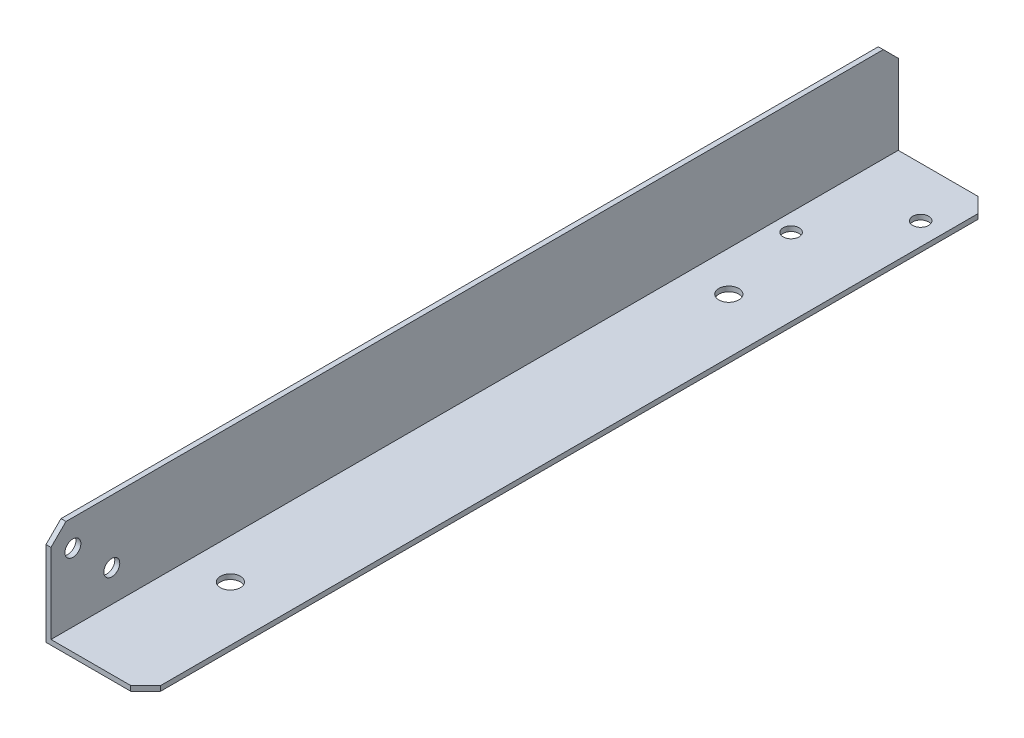
from build123d import *

# Parameters (mm, degrees)
BASE_DEPTH                      = 170
CHAMFER1_SIZE                   = 3
F_4_0_4_CABLE_TIE_HOLES_D       = 4
F_3_1_3_1_CABLECHAINSIDEHOLES_D = 3.2
F_3_2_3_2_CARRIAGESIDE_D        = 3.2


with BuildPart() as part:
    # Sketch1 → Base (new body)
    with BuildSketch(Plane.XY):
        Polygon((0, 0), (20, 0), (20, 1), (1, 1), (1, 20), (0, 20), align=None)
    extrude(amount=BASE_DEPTH)

    # Chamfer1
    chamfer1_edges = [part.edges().sort_by_distance(p)[0] for p in [
        (20, 0.5, 170),
        (0.5, 20, 170),
        (0.5, 20, 0),
        (20, 0.5, 0),
    ]]
    chamfer(chamfer1_edges, length=CHAMFER1_SIZE)

    # Ø4.0 (4) Cable tie Holes (through all)
    with Locations(Plane(origin=(0, 1, 0), x_dir=(1, 0, 0), z_dir=(0, 1, 0))):
        with Locations((9, -42), (9, -142)):
            Hole(F_4_0_4_CABLE_TIE_HOLES_D / 2)

    # Ø3.1 (3.1) CableChainSideHoles (through all)
    with Locations(Plane(origin=(1, 0, 0), x_dir=(0, 0, -1), z_dir=(1, 0, 0))):
        with Locations((-165.6, 14.68), (-157.8, 7.38)):
            Hole(F_3_1_3_1_CABLECHAINSIDEHOLES_D / 2)

    # Ø3.2 (3.2) CarriageSide (through all)
    with Locations(Plane(origin=(0, 1, 0), x_dir=(1, 0, 0), z_dir=(0, 1, 0))):
        with Locations((15.5, -10), (4.5, -25)):
            Hole(F_3_2_3_2_CARRIAGESIDE_D / 2)


solid = part.part
